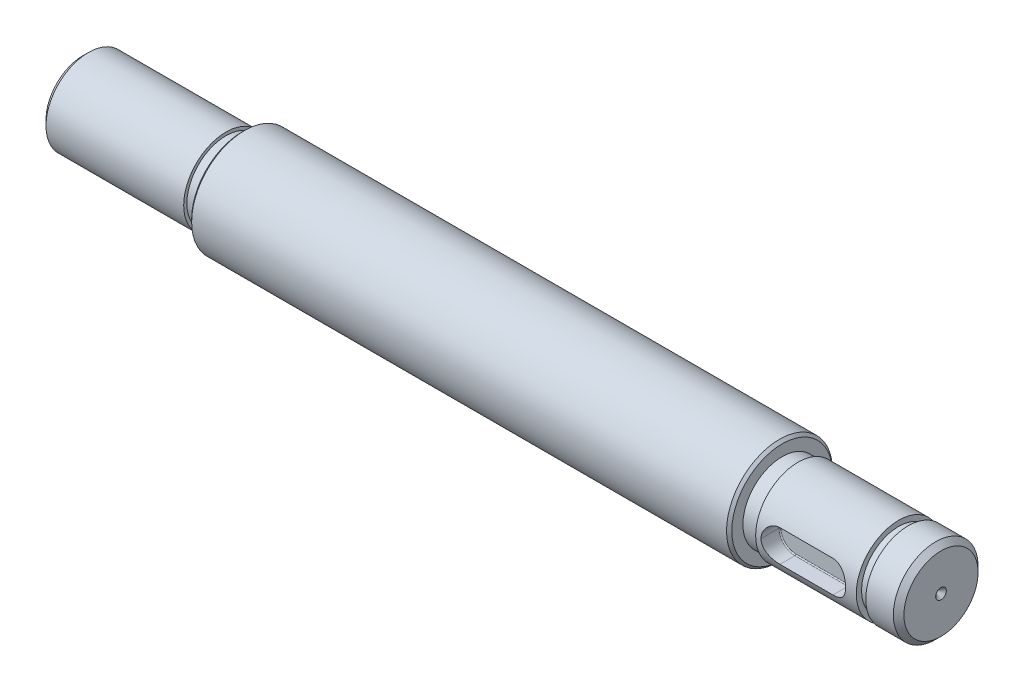
from build123d import *

# Parameters (mm, degrees)
CHAMFER1_SIZE      = 0.5
SKETCH3_W          = 1.5
SKETCH3_H          = 0.3
SKETCH17_W         = 8
SKETCH17_H         = 3
CUT_EXTRUDE4_DEPTH = 1.8
FILLET10_R         = 1.5
FILLET11_R         = 1.5
FILLET12_R         = 0.1
SKETCH29_W         = 0.9
SKETCH29_H         = 0.5


with BuildPart() as part:
    # Sketch1 → Revolve1 (revolve)
    with BuildSketch(Plane.XY, mode=Mode.PRIVATE) as revolve1_sk:
        Polygon((0, 4), (15, 4), (15, 4.75), (15.25, 5), (65.75, 5), (66, 4.75), (66, 4), (81, 4), (81, 0), (0, 0), align=None)
    revolve(revolve1_sk.sketch.rotate(Axis((0, 0, 0), (1, 0, 0)), 90), axis=Axis((0, 0, 0), (1, 0, 0)))

    # Chamfer1
    chamfer1_edges = [part.edges().sort_by_distance(p)[0] for p in [
        (81, 0, -4),
        (0, 0, -4),
    ]]
    chamfer(chamfer1_edges, length=CHAMFER1_SIZE)

    # Sketch2 → Cut-Revolve1 (revolve, cut)
    with BuildSketch(Plane.XY, mode=Mode.PRIVATE) as cut_revolve1_sk:
        Polygon((0, 0.5), (0.5, 0), (0, 0), align=None)
        Polygon((81, 0), (81, 0.5), (80.5, 0), align=None)
    revolve(cut_revolve1_sk.sketch.rotate(Axis((0, 0, 0), (1, 0, 0)), 270), axis=Axis((0, 0, 0), (1, 0, 0)), mode=Mode.SUBTRACT)

    # Sketch3 → Cut-Revolve2 (revolve, cut)
    with BuildSketch(Plane.XY, mode=Mode.PRIVATE) as cut_revolve2_sk:
        with Locations((14.25, 3.85)):
            Rectangle(SKETCH3_W, SKETCH3_H)
        with Locations((66.75, 3.85)):
            Rectangle(SKETCH3_W, SKETCH3_H)
    revolve(cut_revolve2_sk.sketch.rotate(Axis((0, 0, 0), (1, 0, 0)), 90), axis=Axis((0, 0, 0), (1, 0, 0)), mode=Mode.SUBTRACT)

    # Sketch17 → Cut-Extrude4 (cut)
    with BuildSketch(Plane.XY.offset(4)):
        with Locations((72, 0)):
            Rectangle(SKETCH17_W, SKETCH17_H)
    extrude(amount=-CUT_EXTRUDE4_DEPTH, mode=Mode.SUBTRACT)

    # Fillet10
    fillet10_edges = [part.edges().sort_by_distance(p)[0] for p in [
        (76, 1.5, 2.954049622),
        (76, -1.5, 2.954049622),
    ]]
    fillet(fillet10_edges, radius=FILLET10_R - 0.0001)  # a hair under: the kernel refuses the full size

    # Fillet11
    fillet11_edges = [part.edges().sort_by_distance(p)[0] for p in [
        (68, 1.5, 2.954049622),
        (68, -1.5, 2.954049622),
    ]]
    fillet(fillet11_edges, radius=FILLET11_R - 0.0001)  # a hair under: the kernel refuses the full size

    # Fillet12
    fillet12_edges = [part.edges().sort_by_distance(p)[0] for p in [
        (72, 1.5, 2.2),
        (75.560689461, -1.060689461, 2.2),
        (75.560689461, 1.060689461, 2.2),
        (72, -1.5, 2.2),
        (68.439310539, -1.060689461, 2.2),
        (68.439310539, 1.060689461, 2.2),
    ]]
    fillet(fillet12_edges, radius=FILLET12_R)

    # Sketch29 → Cut-Revolve6 (revolve, cut)
    with BuildSketch(Plane.XY, mode=Mode.PRIVATE) as cut_revolve6_sk:
        with Locations((77.45, 3.75)):
            Rectangle(SKETCH29_W, SKETCH29_H)
    revolve(cut_revolve6_sk.sketch.rotate(Axis((81, 0, 0), (-1, 0, 0)), 270), axis=Axis((81, 0, 0), (-1, 0, 0)), mode=Mode.SUBTRACT)


solid = part.part
